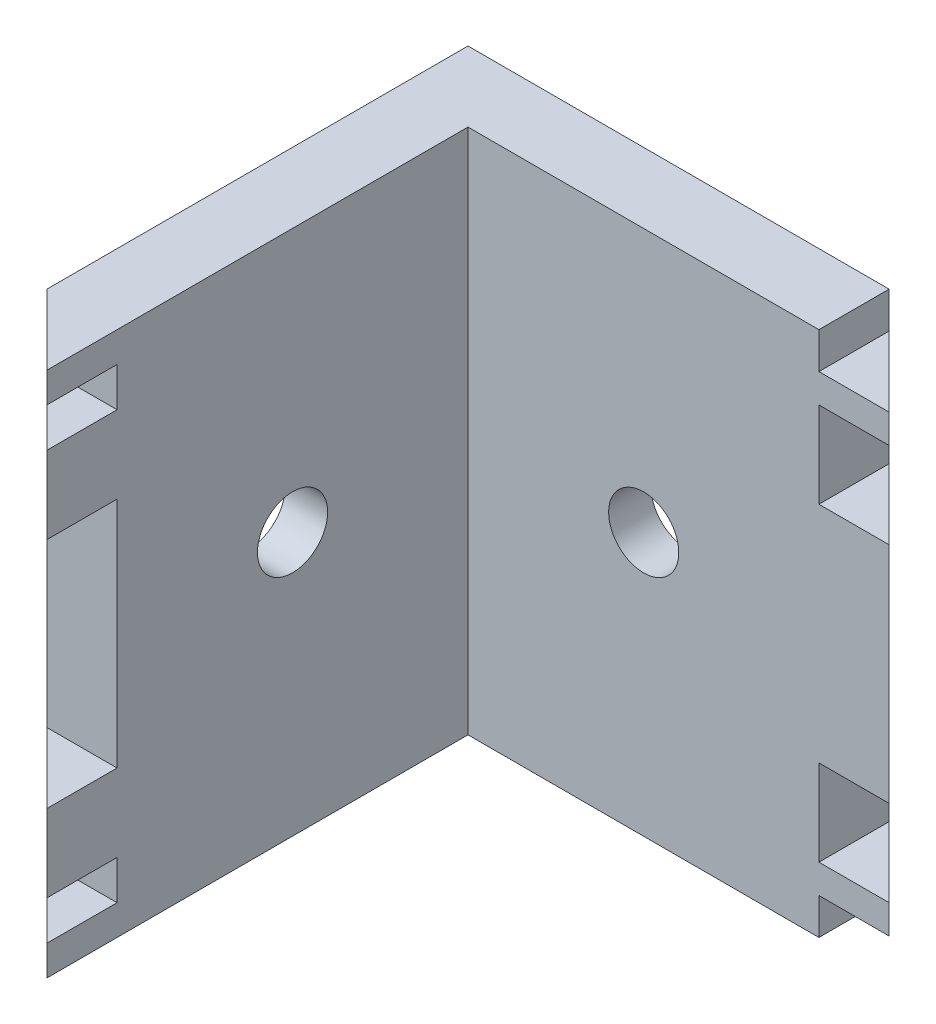
from build123d import *

# Parameters (mm, degrees)
BOSS_EXTRUDE1_DEPTH      = 31.75
BOSS_EXTRUDE1_DEPTH_BACK = 6.35
BODY_MOVE_COPY1_ANGLE    = 90
SKETCH24_W               = 5.08
SKETCH24_H               = 2.84
SKETCH24_H_2             = 16.856
SKETCH24_H_3             = 2.839999908
CUT_EXTRUDE4_DEPTH       = 64.461888563
SKETCH26_W               = 5.08
SKETCH26_H               = 6.225000088
SKETCH26_H_2             = 2.629999912
CUT_EXTRUDE5_DEPTH       = 54.536186827
CHAMFER1_SIZE            = 5.08
CHAMFER2_SIZE            = 5.08
SKETCH29_W               = 12.0839992
SKETCH29_H               = 9.0359992
CUT_EXTRUDE6_DEPTH       = 2
SKETCH28_W               = 12.16937175
SKETCH28_H               = 9.099837858
CUT_EXTRUDE7_DEPTH       = 2
CUT_EXTRUDE8_REACH       = 66.997
SKETCH38_R               = 2.54
CUT_EXTRUDE10_REACH      = 57.348
SKETCH40_R               = 2.54
SKETCH41_W               = 1.905
SKETCH41_H               = 7.62
CUT_EXTRUDE11_DEPTH      = 1.2
SKETCH42_W               = 1.905
SKETCH42_H               = 7.62
CUT_EXTRUDE12_DEPTH      = 1.2


with BuildPart() as part:
    # Sketch1 → Boss-Extrude1 (new, two sides: drawn at the far end of the back side and taken through both)
    with BuildSketch(Plane(origin=(0, 0, 0), x_dir=(1, 0, 0), z_dir=(0, 1, 0)).offset(-BOSS_EXTRUDE1_DEPTH_BACK)):
        Polygon((0, 0), (30.48, 0), (30.48, -5.08), (-5.08, -5.08), (-5.08, 30.48), (0, 30.48), align=None)
    extrude(amount=BOSS_EXTRUDE1_DEPTH + BOSS_EXTRUDE1_DEPTH_BACK)


with BuildPart() as part_1:
    # Body-Move/Copy1: moved
    add(part.part.rotate(Axis((-5.08, 0, 5.08), (0, -1, 0)), BODY_MOVE_COPY1_ANGLE))


with BuildPart() as part_2:
    # Body-Move/Copy2: moved
    add(part_1.part.moved(Location((0, 0, -25.4))))


with BuildPart() as part_3:
    # Body-Move/Copy3: moved
    add(part_2.part.moved(Location((0, 0, -25.4))))

    # Sketch24 → Cut-Extrude4 (cut, through all)
    with BuildSketch(Plane(origin=(0, 0, 0), x_dir=(0, 0, -1), z_dir=(1, 0, 0))):
        with Locations((12.7, 28.15)):
            Rectangle(SKETCH24_W, SKETCH24_H)
        with Locations((12.7, 12.7)):
            Rectangle(SKETCH24_W, SKETCH24_H_2)
        with Locations((12.7, -2.75)):
            Rectangle(SKETCH24_W, SKETCH24_H_3)
    extrude(amount=-CUT_EXTRUDE4_DEPTH, mode=Mode.SUBTRACT)

    # Sketch26 → Cut-Extrude5 (cut, through all)
    with BuildSketch(Plane.XY.offset(-40.64)):
        with Locations((27.94, 23.9175)):
            Rectangle(SKETCH26_W, SKETCH26_H)
        with Locations((27.94, 30.435000044)):
            Rectangle(SKETCH26_W, SKETCH26_H_2)
        with Locations((27.94, 1.4825)):
            Rectangle(SKETCH26_W, SKETCH26_H)
        with Locations((27.94, -5.035000044)):
            Rectangle(SKETCH26_W, SKETCH26_H_2)
    extrude(amount=-CUT_EXTRUDE5_DEPTH, mode=Mode.SUBTRACT)

    # Chamfer1
    chamfer1_edges = [part_3.edges().sort_by_distance(p)[0] for p in [
        (-5.08, -5.259999977, -10.16),
        (-5.08, 1.470999977, -10.16),
        (-5.08, 23.929, -10.16),
        (-5.08, 30.66, -10.16),
    ]]
    chamfer(chamfer1_edges, length=CHAMFER1_SIZE - 0.0001)  # a hair under: the kernel refuses the full size

    # Chamfer2
    chamfer2_edges = [part_3.edges().sort_by_distance(p)[0] for p in [
        (30.48, -2.675000066, -45.72),
        (30.48, 12.7, -45.72),
        (30.48, 28.075000066, -45.72),
    ]]
    chamfer(chamfer2_edges, length=CHAMFER2_SIZE - 0.0001)  # a hair under: the kernel refuses the full size

    # Sketch29 → Cut-Extrude6 (cut)
    with BuildSketch(Plane(origin=(0, 0, -45.72), x_dir=(-1, 0, 0), z_dir=(0, 0, -1))):
        with Locations((-12.7, 12.7)):
            Rectangle(SKETCH29_W, SKETCH29_H)
    extrude(amount=-CUT_EXTRUDE6_DEPTH, mode=Mode.SUBTRACT)

    # Sketch28 → Cut-Extrude7 (cut)
    with BuildSketch(Plane.ZY.offset(5.08)):
        with Locations((-27.94, 12.682393608)):
            Rectangle(SKETCH28_W, SKETCH28_H)
    extrude(amount=-CUT_EXTRUDE7_DEPTH, mode=Mode.SUBTRACT)

    # Sketch38 → Cut-Extrude8 (cut, up to next)
    with BuildSketch(Plane.ZY.offset(3.08), mode=Mode.PRIVATE) as cut_extrude8_sk1:
        with Locations((-27.94, 12.7)):
            Circle(SKETCH38_R)
    cut_extrude8_tool1 = extrude(cut_extrude8_sk1.sketch, amount=-CUT_EXTRUDE8_REACH, mode=Mode.PRIVATE) & part_3.part
    add(cut_extrude8_tool1.solids().sort_by_distance((-3.08, 12.7, -27.94))[0], mode=Mode.SUBTRACT)

    # Sketch40 → Cut-Extrude10 (cut, up to next)
    with BuildSketch(Plane(origin=(0, 0, -43.72), x_dir=(-1, 0, 0), z_dir=(0, 0, -1)), mode=Mode.PRIVATE) as cut_extrude10_sk1:
        with Locations((-12.717733491, 12.7)):
            Circle(SKETCH40_R)
    cut_extrude10_tool1 = extrude(cut_extrude10_sk1.sketch, amount=-CUT_EXTRUDE10_REACH, mode=Mode.PRIVATE) & part_3.part
    add(cut_extrude10_tool1.solids().sort_by_distance((12.717733, 12.7, -43.72))[0], mode=Mode.SUBTRACT)

    # Sketch41 → Cut-Extrude11 (cut)
    with BuildSketch(Plane(origin=(0, 0, -43.72), x_dir=(-1, 0, 0), z_dir=(0, 0, -1))):
        with Locations((-8.400133455, 12.7)):
            Rectangle(SKETCH41_W, SKETCH41_H)
        with Locations((-16.999866545, 12.7)):
            Rectangle(SKETCH41_W, SKETCH41_H)
    extrude(amount=-CUT_EXTRUDE11_DEPTH, mode=Mode.SUBTRACT)

    # Sketch42 → Cut-Extrude12 (cut)
    with BuildSketch(Plane.ZY.offset(3.08)):
        with Locations((-23.640133455, 12.7)):
            Rectangle(SKETCH42_W, SKETCH42_H)
        with Locations((-32.239866545, 12.7)):
            Rectangle(SKETCH42_W, SKETCH42_H)
    extrude(amount=-CUT_EXTRUDE12_DEPTH, mode=Mode.SUBTRACT)


solid = part_3.part
